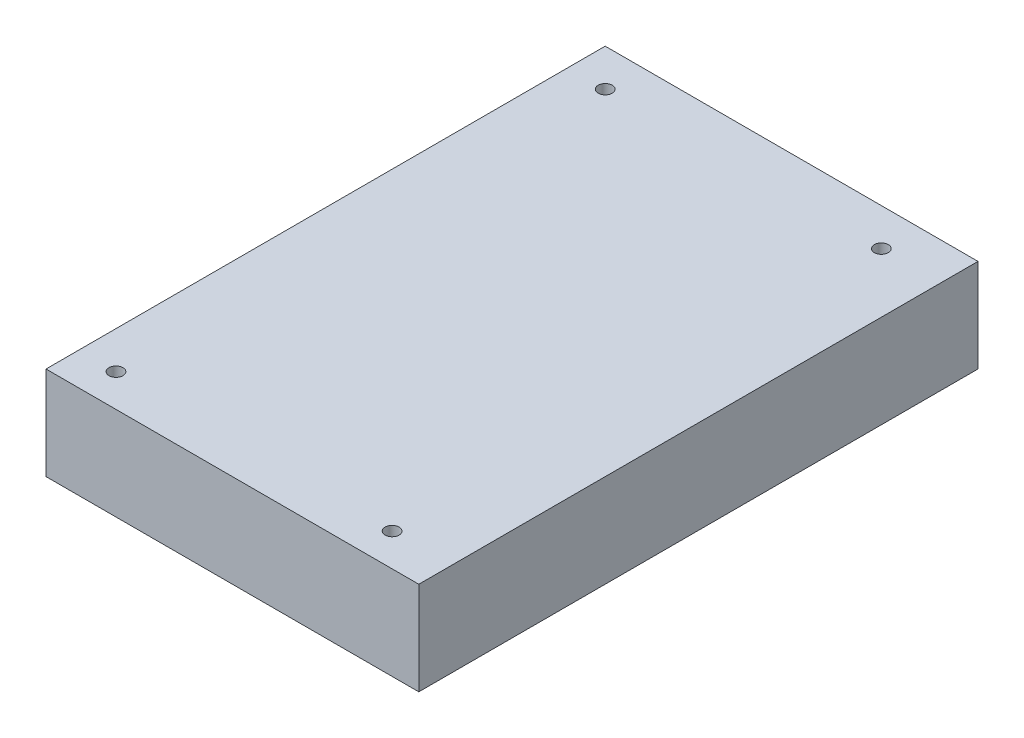
from build123d import *

# Parameters (mm, degrees)
SKETCH1_W           = 101.6
SKETCH1_H           = 152.4
BOSS_EXTRUDE1_DEPTH = 25.4
SKETCH2_R           = 1.905
CUT_EXTRUDE1_DEPTH  = 25.4


with BuildPart() as part:
    # Sketch1 → Boss-Extrude1 (new body)
    with BuildSketch(Plane(origin=(0, 0, 0), x_dir=(1, 0, 0), z_dir=(0, 1, 0))):
        with Locations((15.267759563, 15.82295082)):
            Rectangle(SKETCH1_W, SKETCH1_H)
    extrude(amount=BOSS_EXTRUDE1_DEPTH)

    # Sketch2 → Cut-Extrude1 (cut)
    with BuildSketch(Plane(origin=(0, 25.4, 0), x_dir=(1, 0, 0), z_dir=(0, 1, 0))):
        with Locations((-25.372240437, 81.86295082)):
            Circle(SKETCH2_R)
        with Locations((49.885018027, 81.86295082)):
            Circle(SKETCH2_R)
        with Locations((-25.372240437, -51.47036229)):
            Circle(SKETCH2_R)
        with Locations((49.885018027, -51.47036229)):
            Circle(SKETCH2_R)
    extrude(amount=-CUT_EXTRUDE1_DEPTH, mode=Mode.SUBTRACT)


solid = part.part
